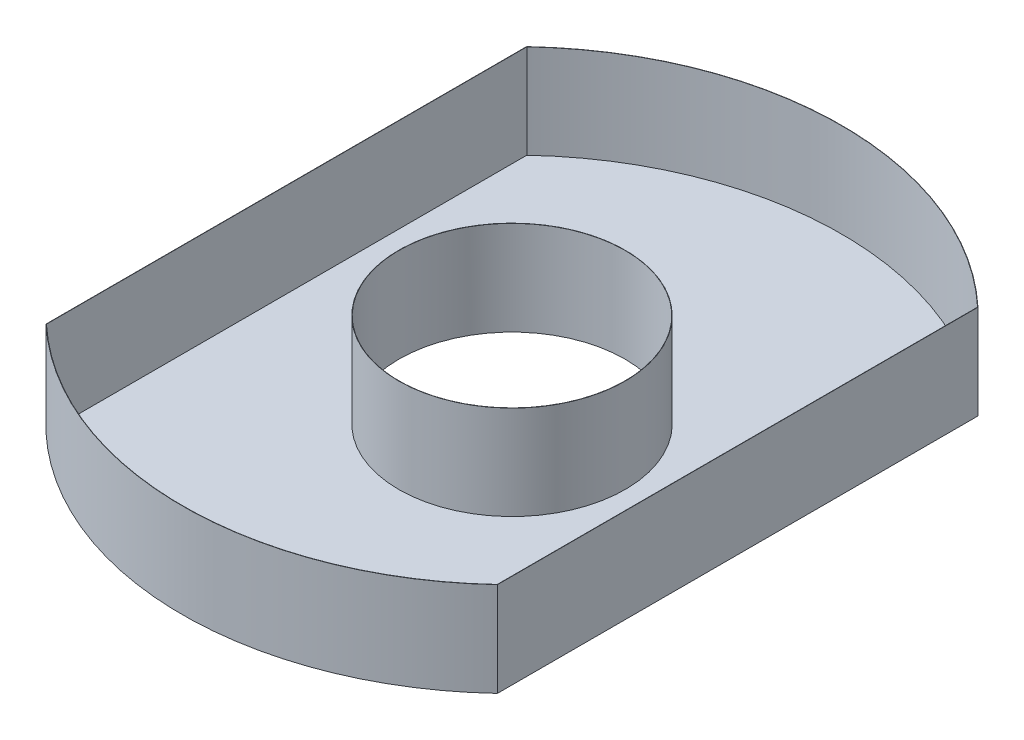
from build123d import *

# Parameters (mm, degrees)
SKETCH1_R               = 1750
BOSS_EXTRUDE1_DEPTH     = 500
CUT_EXTRUDE3_DEPTH      = 2525.876234591
CUT_EXTRUDE3_DEPTH_BACK = 2525.876234591
SKETCH3_R               = 600
CUT_EXTRUDE9_DEPTH      = 2525.876234591
CUT_EXTRUDE9_DEPTH_BACK = 2525.876234591
SKETCH9_W               = 4159.337705958
SKETCH9_H               = 5395.722519788
SKETCH9_W_2             = 2396.11984
SKETCH9_H_2             = 4339.91726
SHELL1_T                = -1.5


with BuildPart() as part:
    # Sketch1 → Boss-Extrude1 (new body)
    with BuildSketch(Plane(origin=(0, 0, 0), x_dir=(1, 0, 0), z_dir=(0, 1, 0))):
        Circle(SKETCH1_R)
    extrude(amount=BOSS_EXTRUDE1_DEPTH)

    # Sketch3 → Cut-Extrude3 (cut, two sides: drawn at the far end of the back side and taken through both)
    with BuildSketch(Plane.XZ.offset(-CUT_EXTRUDE3_DEPTH_BACK)):
        Circle(SKETCH3_R)
    extrude(amount=CUT_EXTRUDE3_DEPTH + CUT_EXTRUDE3_DEPTH_BACK, mode=Mode.SUBTRACT)

    # Sketch9 → Cut-Extrude9 (cut, two sides: drawn at the far end of the back side and taken through both)
    with BuildSketch(Plane(origin=(0, 0, 0), x_dir=(-1, 0, 0), z_dir=(0, -1, 0)).offset(-CUT_EXTRUDE9_DEPTH_BACK)):
        Rectangle(SKETCH9_W, SKETCH9_H)
        Rectangle(SKETCH9_W_2, SKETCH9_H_2, mode=Mode.SUBTRACT)
    extrude(amount=CUT_EXTRUDE9_DEPTH + CUT_EXTRUDE9_DEPTH_BACK, mode=Mode.SUBTRACT)

    # Shell1
    shell1_openings = [part.faces().sort_by_distance(p)[0] for p in [
        (1155.643660986, 500, 0),
    ]]
    offset(amount=SHELL1_T, openings=shell1_openings, kind=Kind.INTERSECTION)


solid = part.part
